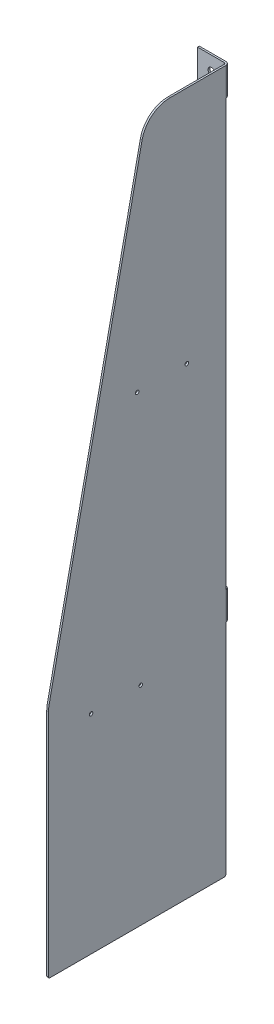
from build123d import *

# Parameters (mm, degrees)
BOSS_EXTRUDE2_DEPTH        = 3.175
SKETCH2_W                  = 3.175
SKETCH2_H                  = 50.8
BOSS_EXTRUDE3_DEPTH        = 50.8
FILLET3_R                  = 6.35
F_1_2_0_5_DIAMETER_HOLE1_D = 12.7
FILLET4_R                  = 3.175
SKETCH6_W                  = 3.175
SKETCH6_H                  = 317.5
BOSS_EXTRUDE4_DEPTH        = 342.9
FILLET5_R                  = 2.54


with BuildPart() as part:
    # Sketch1 → Boss-Extrude2 (new body)
    with BuildSketch(Plane(origin=(0, 0, 0), x_dir=(0, 0, -1), z_dir=(1, 0, 0))):
        with BuildLine():
            Line((-317.5, 0), (0, 0))
            Line((0, 0), (0, 50.8))
            Line((0, 50.8), (6.35, 50.8))
            Line((6.35, 50.8), (6.35, 101.6))
            Line((6.35, 101.6), (0, 101.6))
            Line((0, 101.6), (0, 559.756235294))
            Line((0, 559.756235294), (0, 863.6))
            Line((0, 863.6), (6.35, 863.6))
            Line((6.35, 863.6), (6.35, 914.4))
            Line((6.35, 914.4), (-100.150182785, 914.4))
            ThreePointArc((-100.150182785, 914.4), (-132.16586597, 903.041552077), (-149.864680249, 874.045513001))
            Line((-149.864680249, 874.045513001), (-316.414497465, 81.366353538))
            ThreePointArc((-316.414497465, 81.366353538), (-317.227895618, 76.171722787), (-317.5, 70.920840537))
            Line((-317.5, 70.920840537), (-317.5, 0))
        make_face()
        with BuildLine():
            ThreePointArc((-244.475, 29.604131036), (-241.3, 32.779131036), (-238.125, 29.604131036))
            ThreePointArc((-238.125, 29.604131036), (-241.3, 26.429131036), (-244.475, 29.604131036))
        make_face(mode=Mode.SUBTRACT)
        with BuildLine():
            ThreePointArc((-149.225, 29.604131036), (-152.4, 26.429131036), (-155.575, 29.604131036))
            ThreePointArc((-155.575, 29.604131036), (-152.4, 32.779131036), (-149.225, 29.604131036))
        make_face(mode=Mode.SUBTRACT)
        with BuildLine():
            ThreePointArc((-161.925, 486.804131036), (-158.75, 489.979131036), (-155.575, 486.804131036))
            ThreePointArc((-155.575, 486.804131036), (-158.75, 483.629131036), (-161.925, 486.804131036))
        make_face(mode=Mode.SUBTRACT)
        with BuildLine():
            ThreePointArc((-66.675, 486.804131036), (-69.85, 483.629131036), (-73.025, 486.804131036))
            ThreePointArc((-73.025, 486.804131036), (-69.85, 489.979131036), (-66.675, 486.804131036))
        make_face(mode=Mode.SUBTRACT)
    extrude(amount=BOSS_EXTRUDE2_DEPTH)

    # Sketch2 → Boss-Extrude3 (add)
    with BuildSketch(Plane.ZY):
        with Locations((-4.7625, 889)):
            Rectangle(SKETCH2_W, SKETCH2_H)
        with Locations((-4.7625, 76.2)):
            Rectangle(SKETCH2_W, SKETCH2_H)
    extrude(amount=BOSS_EXTRUDE3_DEPTH)

    # Fillet3
    fillet3_edges = [part.edges().sort_by_distance(p)[0] for p in [
        (3.175, 76.2, -6.35),
        (3.175, 889, -6.35),
    ]]
    fillet(fillet3_edges, radius=FILLET3_R)

    # 1/2 (0.5) Diameter Hole1 (through all)
    with Locations(Plane.XY.offset(-3.175)):
        with Locations((-25.4, 76.2), (-25.4, 889)):
            Hole(F_1_2_0_5_DIAMETER_HOLE1_D / 2)

    # Fillet4
    fillet4_edges = [part.edges().sort_by_distance(p)[0] for p in [
        (0, 889, -3.175),
        (0, 76.2, -3.175),
    ]]
    fillet(fillet4_edges, radius=FILLET4_R)

    # Sketch6 → Boss-Extrude4 (add)
    with BuildSketch(Plane.XZ):
        with Locations((1.5875, 158.75)):
            Rectangle(SKETCH6_W, SKETCH6_H)
    extrude(amount=BOSS_EXTRUDE4_DEPTH)

    # Fillet5
    fillet5_edges = [part.edges().sort_by_distance(p)[0] for p in [
        (1.5875, -342.9, 0),
        (1.5875, -342.9, 317.5),
    ]]
    fillet(fillet5_edges, radius=FILLET5_R)


solid = part.part
